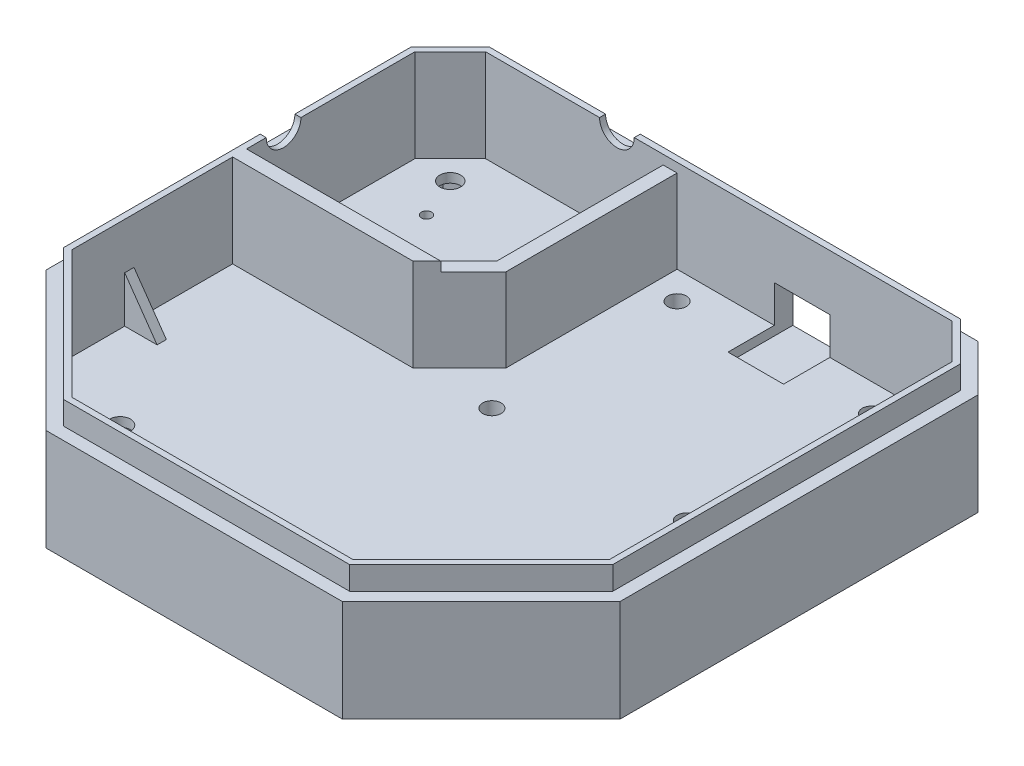
from build123d import *

# Parameters (mm, degrees)
ESQUISSE1_W              = 124
ESQUISSE1_H              = 117.31
ESQUISSE1_R              = 2.25
BOSS_EXTRU_1_DEPTH       = 7
CHANFREIN1_SIZE          = 30
CHANFREIN2_SIZE          = 10
ESQUISSE1_4_R            = 2.25
ENL_V_MAT_EXTRU_1_DEPTH  = 5
BOSS_EXTRU_2_START       = 7
BOSS_EXTRU_2_DEPTH       = 15
BOSS_EXTRU_3_START       = 7
BOSS_EXTRU_3_DEPTH       = 20
ENL_V_START              = -113.31
ESQUISSE4_R              = 3.75
ENL_V_MAT_EXTRU_5_DEPTH  = 10
ESQUISSE3_R              = 3.75
ENL_V_MAT_EXTRU_6_DEPTH  = 10
ESQUISSE6_R              = 2
ENL_V_MAT_EXTRU_7_DEPTH  = 10
ESQUISSE6_8_R            = 2
ENL_V_MAT_EXTRU_8_DEPTH  = 4
ENL_V_START_2            = 5
ESQUISSE6_9_W            = 8.5
ESQUISSE6_9_H            = 7.5
ESQUISSE6_9_H_2          = 1.6
ENL_V_MAT_EXTRU_9_DEPTH  = 10
NERVURE1_START           = -1
NERVURE1_DEPTH           = 2
NERVURE3_REACH           = 146.536
ESQUISSE9_WALL_W         = 303.278422804
ESQUISSE9_WALL_H         = 2
NERVURE6_START           = -1
NERVURE6_DEPTH           = 2
NERVURE7_REACH           = 148.558
ESQUISSE11_WALL_W        = 307.323297546
ESQUISSE11_WALL_H        = 2
ENL_V_MAT_EXTRU_11_DEPTH = 10
BOSS_EXTRU_4_DEPTH       = 2
BOSS_EXTRU_4_DEPTH_BACK  = 1
ESQUISSE14_W             = 45
ESQUISSE14_H             = 18
BOSS_EXTRU_5_DEPTH       = 2
BOSS_EXTRU_5_DEPTH_BACK  = 1
ESQUISSE15_W             = 49
ESQUISSE15_H             = 20
CHANFREIN3_SIZE          = 8
CHANFREIN4_SIZE          = 10
NERVURE8_REACH           = 153.808
ESQUISSE16_WALL_W        = 317.831069122
ESQUISSE16_WALL_H        = 2


# Read off the part's stored shape, not the designer's step: Nervure1, Nervure6
with BuildPart() as part:
    # Esquisse1 → Boss.-Extru.1 (new body)
    # profile 1 of 5: a face of its own
    with BuildSketch(Plane(origin=(0, 0, 0), x_dir=(1, 0, 0), z_dir=(0, 1, 0))):
        with Locations((62, 58.655)):
            Rectangle(ESQUISSE1_W, ESQUISSE1_H)
        Polygon((22, 19.669872981), (25.75, 21.834936491), (25.75, 26.165063509), (22, 28.330127019), (18.25, 26.165063509), (18.25, 21.834936491), align=None, mode=Mode.SUBTRACT)
        Polygon((12, 100.979872981), (15.75, 103.144936491), (15.75, 107.475063509), (12, 109.640127019), (8.25, 107.475063509), (8.25, 103.144936491), align=None, mode=Mode.SUBTRACT)
        Polygon((102, 19.669872981), (98.25, 21.834936491), (98.25, 26.165063509), (102, 28.330127019), (105.75, 26.165063509), (105.75, 21.834936491), align=None, mode=Mode.SUBTRACT)
        Polygon((112, 100.979872981), (108.25, 103.144936491), (108.25, 107.475063509), (112, 109.640127019), (115.75, 107.475063509), (115.75, 103.144936491), align=None, mode=Mode.SUBTRACT)
    # profile 2 of 5: a face of its own
    with BuildSketch(Plane(origin=(0, 0, 0), x_dir=(1, 0, 0), z_dir=(0, 1, 0))):
        Polygon((18.25, 21.834936491), (22, 19.669872981), (25.75, 21.834936491), (25.75, 26.165063509), (22, 28.330127019), (18.25, 26.165063509), align=None)
        with Locations(Location((22, 24, 0), (0, 0, 270))):
            Circle(ESQUISSE1_R, mode=Mode.SUBTRACT)
    # profile 3 of 5: a face of its own
    with BuildSketch(Plane(origin=(0, 0, 0), x_dir=(1, 0, 0), z_dir=(0, 1, 0))):
        Polygon((8.25, 103.144936491), (12, 100.979872981), (15.75, 103.144936491), (15.75, 107.475063509), (12, 109.640127019), (8.25, 107.475063509), align=None)
        with Locations(Location((12, 105.31, 0), (0, 0, 270))):
            Circle(ESQUISSE1_R, mode=Mode.SUBTRACT)
    # profile 4 of 5: a face of its own
    with BuildSketch(Plane(origin=(0, 0, 0), x_dir=(1, 0, 0), z_dir=(0, 1, 0))):
        Polygon((108.25, 103.144936491), (108.25, 107.475063509), (112, 109.640127019), (115.75, 107.475063509), (115.75, 103.144936491), (112, 100.979872981), align=None)
        with Locations(Location((112, 105.31, 0), (0, 0, 270))):
            Circle(ESQUISSE1_R, mode=Mode.SUBTRACT)
    # profile 5 of 5: a face of its own
    with BuildSketch(Plane(origin=(0, 0, 0), x_dir=(1, 0, 0), z_dir=(0, 1, 0))):
        Polygon((98.25, 21.834936491), (98.25, 26.165063509), (102, 28.330127019), (105.75, 26.165063509), (105.75, 21.834936491), (102, 19.669872981), align=None)
        with Locations(Location((102, 24, 0), (0, 0, 270))):
            Circle(ESQUISSE1_R, mode=Mode.SUBTRACT)
    extrude(amount=BOSS_EXTRU_1_DEPTH)

    # Chanfrein1
    chanfrein1_edges = [part.edges().sort_by_distance(p)[0] for p in [
        (0, 3.5, 0),
        (124, 3.5, 0),
    ]]
    chamfer(chanfrein1_edges, length=CHANFREIN1_SIZE)

    # Chanfrein2
    chanfrein2_edges = [part.edges().sort_by_distance(p)[0] for p in [
        (0, 3.5, -117.31),
        (124, 3.5, -117.31),
    ]]
    chamfer(chanfrein2_edges, length=CHANFREIN2_SIZE)

    # Esquisse1<4> → Enlèv. mat.-Extru.1 (cut)
    # profile 1 of 4: a face of its own
    with BuildSketch(Plane(origin=(0, 0, 0), x_dir=(1, 0, 0), z_dir=(0, 1, 0))):
        Polygon((8.25, 103.144936491), (12, 100.979872981), (15.75, 103.144936491), (15.75, 107.475063509), (12, 109.640127019), (8.25, 107.475063509), align=None)
        with Locations(Location((12, 105.31, 0), (0, 0, 270))):
            Circle(ESQUISSE1_4_R, mode=Mode.SUBTRACT)
    # profile 2 of 4: a face of its own
    with BuildSketch(Plane(origin=(0, 0, 0), x_dir=(1, 0, 0), z_dir=(0, 1, 0))):
        Polygon((18.25, 21.834936491), (22, 19.669872981), (25.75, 21.834936491), (25.75, 26.165063509), (22, 28.330127019), (18.25, 26.165063509), align=None)
        with Locations(Location((22, 24, 0), (0, 0, 270))):
            Circle(ESQUISSE1_4_R, mode=Mode.SUBTRACT)
    # profile 3 of 4: a face of its own
    with BuildSketch(Plane(origin=(0, 0, 0), x_dir=(1, 0, 0), z_dir=(0, 1, 0))):
        Polygon((98.25, 21.834936491), (98.25, 26.165063509), (102, 28.330127019), (105.75, 26.165063509), (105.75, 21.834936491), (102, 19.669872981), align=None)
        with Locations(Location((102, 24, 0), (0, 0, 270))):
            Circle(ESQUISSE1_4_R, mode=Mode.SUBTRACT)
    # profile 4 of 4: a face of its own
    with BuildSketch(Plane(origin=(0, 0, 0), x_dir=(1, 0, 0), z_dir=(0, 1, 0))):
        Polygon((108.25, 103.144936491), (108.25, 107.475063509), (112, 109.640127019), (115.75, 107.475063509), (115.75, 103.144936491), (112, 100.979872981), align=None)
        with Locations(Location((112, 105.31, 0), (0, 0, 270))):
            Circle(ESQUISSE1_4_R, mode=Mode.SUBTRACT)
    extrude(amount=ENL_V_MAT_EXTRU_1_DEPTH, mode=Mode.SUBTRACT)

    # Esquisse2 → Boss.-Extru.2 (add)
    with BuildSketch(Plane(origin=(0, 0, 0), x_dir=(1, 0, 0), z_dir=(0, 1, 0)).offset(BOSS_EXTRU_2_START)):
        Polygon((0, 30), (0, 107.31), (10, 117.31), (114, 117.31), (124, 107.31), (124, 30), (94, 0), (30, 0), align=None)
        Polygon((92.881623382, 2.7), (31.118376618, 2.7), (2.7, 31.118376618), (2.7, 106.191623382), (11.118376618, 114.61), (112.881623382, 114.61), (121.3, 106.191623382), (121.3, 31.118376618), align=None, mode=Mode.SUBTRACT)
    extrude(amount=BOSS_EXTRU_2_DEPTH)

    # Esquisse2<3> → Boss.-Extru.3 (add)
    with BuildSketch(Plane(origin=(0, 0, 0), x_dir=(1, 0, 0), z_dir=(0, 1, 0)).offset(BOSS_EXTRU_3_START)):
        Polygon((31.118376618, 2.7), (2.7, 31.118376618), (2.7, 106.191623382), (11.118376618, 114.61), (112.881623382, 114.61), (121.3, 106.191623382), (121.3, 31.118376618), (92.881623382, 2.7), align=None)
        Polygon((31.656854249, 4), (4, 31.656854249), (4, 105.653145751), (11.656854249, 113.31), (112.343145751, 113.31), (120, 105.653145751), (120, 31.656854249), (92.343145751, 4), align=None, mode=Mode.SUBTRACT)
    extrude(amount=BOSS_EXTRU_3_DEPTH)

    # Esquisse4 → Enlèv. mat.-Extru.5 (cut)
    with BuildSketch(Plane.XY.offset(ENL_V_START)):
        with Locations((40, 27)):
            Circle(ESQUISSE4_R)
    extrude(amount=-ENL_V_MAT_EXTRU_5_DEPTH, mode=Mode.SUBTRACT)

    # Esquisse3 → Enlèv. mat.-Extru.6 (cut)
    with BuildSketch(Plane(origin=(0, 0, 0), x_dir=(0, 0, -1), z_dir=(1, 0, 0))):
        with Locations((77.31, 27)):
            Circle(ESQUISSE3_R)
    extrude(amount=ENL_V_MAT_EXTRU_6_DEPTH, mode=Mode.SUBTRACT)

    # Esquisse6 → Enlèv. mat.-Extru.7 (cut)
    with BuildSketch(Plane(origin=(0, 0, 0), x_dir=(1, 0, 0), z_dir=(0, 1, 0))):
        with Locations(Location((101, 107.31, 0), (0, 0, 270))):
            Circle(ESQUISSE6_R)
        with Locations(Location((59, 107.31, 0), (0, 0, 270))):
            Circle(ESQUISSE6_R)
        with Locations(Location((59, 67.31, 0), (0, 0, 270))):
            Circle(ESQUISSE6_R)
        with Locations(Location((101, 67.31, 0), (0, 0, 270))):
            Circle(ESQUISSE6_R)
    extrude(amount=ENL_V_MAT_EXTRU_7_DEPTH, mode=Mode.SUBTRACT)

    # Esquisse6<8> → Enlèv. mat.-Extru.8 (cut)
    # profile 1 of 4: a face of its own
    with BuildSketch(Plane(origin=(0, 0, 0), x_dir=(1, 0, 0), z_dir=(0, 1, 0))):
        Polygon((98, 109.042050808), (98, 105.577949192), (101, 103.845898385), (104, 105.577949192), (104, 109.042050808), (101, 110.774101615), align=None)
        with Locations(Location((101, 107.31, 0), (0, 0, 270))):
            Circle(ESQUISSE6_8_R, mode=Mode.SUBTRACT)
    # profile 2 of 4: a face of its own
    with BuildSketch(Plane(origin=(0, 0, 0), x_dir=(1, 0, 0), z_dir=(0, 1, 0))):
        Polygon((56, 109.042050808), (56, 105.577949192), (59, 103.845898385), (62, 105.577949192), (62, 109.042050808), (59, 110.774101615), align=None)
        with Locations(Location((59, 107.31, 0), (0, 0, 270))):
            Circle(ESQUISSE6_8_R, mode=Mode.SUBTRACT)
    # profile 3 of 4: a face of its own
    with BuildSketch(Plane(origin=(0, 0, 0), x_dir=(1, 0, 0), z_dir=(0, 1, 0))):
        Polygon((56, 69.042050808), (56, 65.577949192), (59, 63.845898385), (62, 65.577949192), (62, 69.042050808), (59, 70.774101615), align=None)
        with Locations(Location((59, 67.31, 0), (0, 0, 270))):
            Circle(ESQUISSE6_8_R, mode=Mode.SUBTRACT)
    # profile 4 of 4: a face of its own
    with BuildSketch(Plane(origin=(0, 0, 0), x_dir=(1, 0, 0), z_dir=(0, 1, 0))):
        Polygon((98, 69.042050808), (98, 65.577949192), (101, 63.845898385), (104, 65.577949192), (104, 69.042050808), (101, 70.774101615), align=None)
        with Locations(Location((101, 67.31, 0), (0, 0, 270))):
            Circle(ESQUISSE6_8_R, mode=Mode.SUBTRACT)
    extrude(amount=ENL_V_MAT_EXTRU_8_DEPTH, mode=Mode.SUBTRACT)

    # Esquisse6<9> → Enlèv. mat.-Extru.9 (cut)
    with BuildSketch(Plane(origin=(0, 0, 0), x_dir=(1, 0, 0), z_dir=(0, 1, 0)).offset(ENL_V_START_2)):
        Polygon((74, 117.31), (74, 112.31), (75.75, 112.31), (75.75, 113.91), (84.25, 113.91), (84.25, 112.31), (86, 112.31), (86, 117.31), align=None)
        Polygon((75.75, 112.31), (74, 112.31), (74, 103.31), (86, 103.31), (86, 112.31), (84.25, 112.31), (84.25, 104.81), (75.75, 104.81), align=None)
        with Locations((80, 108.56)):
            Rectangle(ESQUISSE6_9_W, ESQUISSE6_9_H)
        with Locations((80, 113.11)):
            Rectangle(ESQUISSE6_9_W, ESQUISSE6_9_H_2)
    extrude(amount=ENL_V_MAT_EXTRU_9_DEPTH, mode=Mode.SUBTRACT)

    # Nervure1 outline → Nervure1 (add)
    with BuildSketch(Plane(origin=(44, 0, 0), x_dir=(0, 0, -1), z_dir=(1, 0, 0)).offset(NERVURE1_START)):
        Polygon((11, 7), (4, 17), (4, 7), align=None)
    extrude(amount=NERVURE1_DEPTH)

    # Esquisse9 wall → Nervure3 (add, up to next)
    with BuildSketch(Plane(origin=(80, 12, -7.5), x_dir=(0, -0.819231920519, -0.573462344363), z_dir=(0, -0.573462344363, 0.819231920519)), mode=Mode.PRIVATE) as nervure3_sk1:
        Rectangle(ESQUISSE9_WALL_W, ESQUISSE9_WALL_H)
    nervure3_tool1 = extrude(nervure3_sk1.sketch, amount=NERVURE3_REACH, mode=Mode.PRIVATE) - part.part
    add(nervure3_tool1.solids().sort_by_distance((80, 12, -7.5))[0])

    # Nervure6 outline → Nervure6 (add)
    with BuildSketch(Plane(origin=(0, 0, -44), x_dir=(-1, 0, 0), z_dir=(0, 0, -1)).offset(NERVURE6_START)):
        Polygon((-112.98387136, 7), (-120, 17), (-120, 7), align=None)
    extrude(amount=NERVURE6_DEPTH)

    # Esquisse11 wall → Nervure7 (add, up to next)
    with BuildSketch(Plane(origin=(7.5, 12, -44), x_dir=(0.573462344363, -0.819231920519, 0), z_dir=(-0.819231920519, -0.573462344363, 0)), mode=Mode.PRIVATE) as nervure7_sk1:
        Rectangle(ESQUISSE11_WALL_W, ESQUISSE11_WALL_H)
    nervure7_tool1 = extrude(nervure7_sk1.sketch, amount=NERVURE7_REACH, mode=Mode.PRIVATE) - part.part
    add(nervure7_tool1.solids().sort_by_distance((7.5, 12, -44))[0])

    # Esquisse13 → Enlèv. mat.-Extru.11 (cut)
    with BuildSketch(Plane(origin=(57.878823339, 0, -164.935388349), x_dir=(-1, 0, 0), z_dir=(0, 1, 0))):
        with BuildLine():
            ThreePointArc((40.983764069, 68.555579041), (42.083764069, 67.455579041), (43.183764069, 68.555579041))
            Line((43.183764069, 68.555579041), (40.983764069, 68.555579041))
        make_face()
        with BuildLine():
            Line((40.983764069, 68.555579041), (43.183764069, 68.555579041))
            ThreePointArc((43.183764069, 68.555579041), (42.083764069, 69.655579041), (40.983764069, 68.555579041))
        make_face()
        with BuildLine():
            ThreePointArc((40.983764069, 88.555579041), (42.083764069, 87.455579041), (43.183764069, 88.555579041))
            Line((43.183764069, 88.555579041), (40.983764069, 88.555579041))
        make_face()
        with BuildLine():
            Line((40.983764069, 88.555579041), (43.183764069, 88.555579041))
            ThreePointArc((43.183764069, 88.555579041), (42.083764069, 89.655579041), (40.983764069, 88.555579041))
        make_face()
        with BuildLine():
            ThreePointArc((11.783764069, 79.655579041), (10.683764069, 78.555579041), (11.783764069, 77.455579041))
            Line((11.783764069, 77.455579041), (11.783764069, 79.655579041))
        make_face()
        with BuildLine():
            Line((11.783764069, 79.655579041), (11.783764069, 77.455579041))
            ThreePointArc((11.783764069, 77.455579041), (12.561581528, 77.777761581), (12.883764069, 78.555579041))
            ThreePointArc((12.883764069, 78.555579041), (12.561581528, 79.3333965), (11.783764069, 79.655579041))
        make_face()
    extrude(amount=ENL_V_MAT_EXTRU_11_DEPTH, mode=Mode.SUBTRACT)

    # Esquisse14 → Boss.-Extru.4 (add, two sides: drawn at the far end of the back side and taken through both)
    with BuildSketch(Plane(origin=(51, 0, 0), x_dir=(0, 0, -1), z_dir=(1, 0, 0)).offset(-BOSS_EXTRU_4_DEPTH_BACK)):
        with Locations((90.81, 16)):
            Rectangle(ESQUISSE14_W, ESQUISSE14_H)
    extrude(amount=BOSS_EXTRU_4_DEPTH + BOSS_EXTRU_4_DEPTH_BACK)

    # Esquisse15 → Boss.-Extru.5 (add, two sides: drawn at the far end of the back side and taken through both)
    with BuildSketch(Plane.XY.offset(-68.31).offset(-BOSS_EXTRU_5_DEPTH_BACK)):
        with Locations((28.5, 17)):
            Rectangle(ESQUISSE15_W, ESQUISSE15_H)
    extrude(amount=BOSS_EXTRU_5_DEPTH + BOSS_EXTRU_5_DEPTH_BACK)

    # Chanfrein3
    chanfrein3_edges = [part.edges().sort_by_distance(p)[0] for p in [
        (50, 16, -69.31),
    ]]
    chamfer(chanfrein3_edges, length=CHANFREIN3_SIZE)

    # Chanfrein4
    chanfrein4_edges = [part.edges().sort_by_distance(p)[0] for p in [
        (53, 17, -66.31),
    ]]
    chamfer(chanfrein4_edges, length=CHANFREIN4_SIZE)

    # Esquisse16 wall → Nervure8 (add, up to next)
    with BuildSketch(Plane(origin=(116.49193568, 12, -83.31), x_dir=(-0.574348121974, -0.818611162143, 0), z_dir=(0.818611162143, -0.574348121974, 0)), mode=Mode.PRIVATE) as nervure8_sk1:
        Rectangle(ESQUISSE16_WALL_W, ESQUISSE16_WALL_H)
    nervure8_tool1 = extrude(nervure8_sk1.sketch, amount=NERVURE8_REACH, mode=Mode.PRIVATE) - part.part
    add(nervure8_tool1.solids().sort_by_distance((116.49193568, 12, -83.31))[0])


solid = part.part
